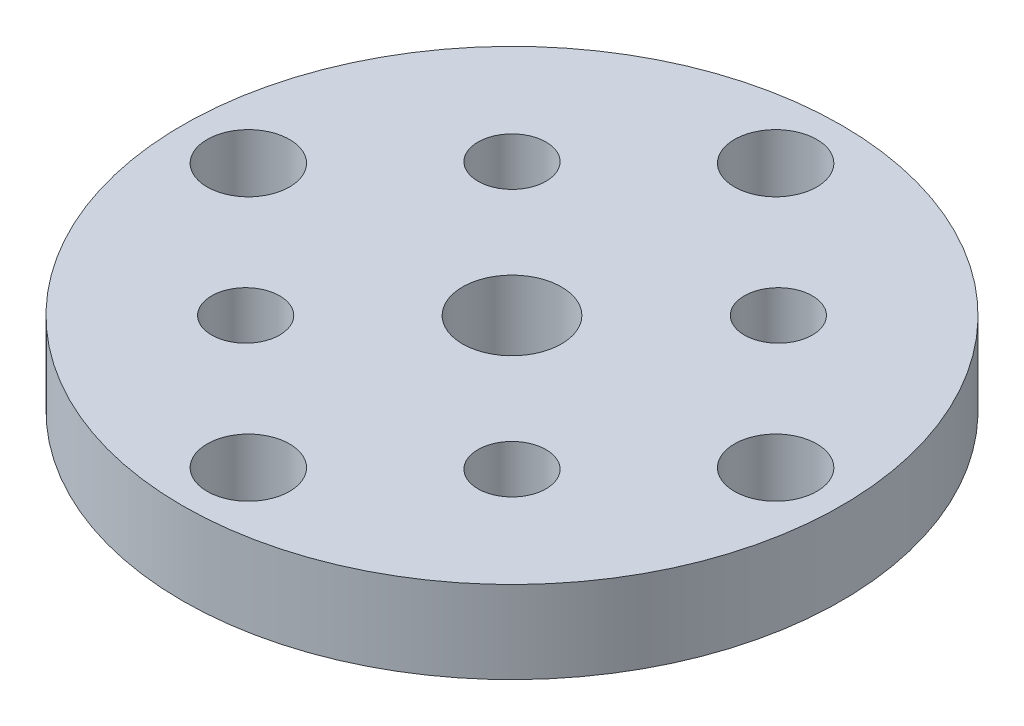
from build123d import *

# Parameters (mm, degrees)
SKETCH1_R           = 10
SKETCH1_R_2         = 1.25
SKETCH1_R_3         = 1.5
BOSS_EXTRUDE1_DEPTH = 2.5
SKETCH2_R           = 1.03251
CUT_EXTRUDE1_DEPTH  = 15.361406616


with BuildPart() as part:
    # Sketch1 → Boss-Extrude1 (new body)
    with BuildSketch(Plane(origin=(0, 0, 0), x_dir=(1, 0, 0), z_dir=(0, 1, 0))):
        Circle(SKETCH1_R)
        with Locations((0, -8)):
            Circle(SKETCH1_R_2, mode=Mode.SUBTRACT)
        with Locations((8, 0)):
            Circle(SKETCH1_R_2, mode=Mode.SUBTRACT)
        with Locations((-8, 0)):
            Circle(SKETCH1_R_2, mode=Mode.SUBTRACT)
        Circle(SKETCH1_R_3, mode=Mode.SUBTRACT)
        with Locations((0, 8)):
            Circle(SKETCH1_R_2, mode=Mode.SUBTRACT)
    extrude(amount=BOSS_EXTRUDE1_DEPTH)

    # Sketch2 → Cut-Extrude1 (cut, through all)
    with BuildSketch(Plane(origin=(0, 2.5, 0), x_dir=(1, 0, 0), z_dir=(0, 1, 0))):
        with Locations((-4.041115254, 4.041115254)):
            Circle(SKETCH2_R)
        with Locations((4.041115254, 4.041115254)):
            Circle(SKETCH2_R)
        with Locations((4.041115254, -4.041115254)):
            Circle(SKETCH2_R)
        with Locations((-4.041115254, -4.041115254)):
            Circle(SKETCH2_R)
    extrude(amount=-CUT_EXTRUDE1_DEPTH, mode=Mode.SUBTRACT)


solid = part.part
